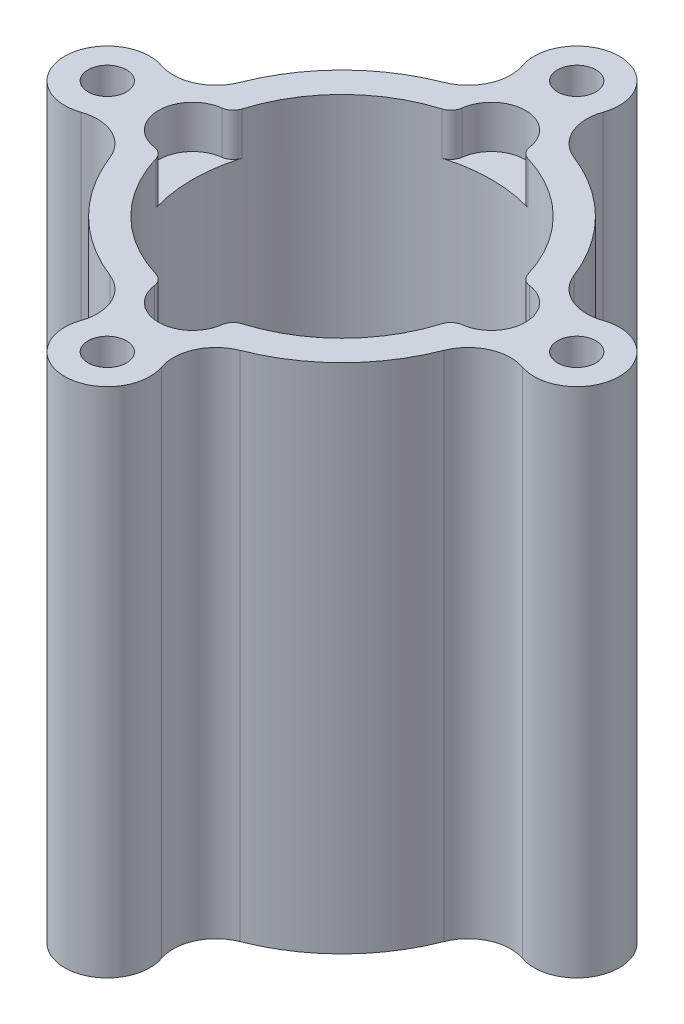
from build123d import *

# Parameters (mm, degrees)
SKETCH_1_R          = 2.25
SKETCH_1_R_2        = 17.5
EXTRUDE_1_DEPTH     = 60
CUT_EXTRUDE_START   = -5
CUT_EXTRUDE_1_DEPTH = 5


with BuildPart() as part:
    # ｽｹｯﾁ1 → ﾎﾞｽ - 押し出し1 (new body)
    with BuildSketch(Plane(origin=(0, 0, 0), x_dir=(1, 0, 0), z_dir=(0, 1, 0))):
        with BuildLine():
            ThreePointArc((7.630853773, 19.56451049), (4.908133096, 22.126989461), (4.72386186, 25.861363636))
            ThreePointArc((4.72386186, 25.861363636), (4.887569521, 26.445645137), (4.979295977, 27.045454545))
            ThreePointArc((4.979295977, 27.045454545), (0, 32.5), (-4.979295977, 27.045454545))
            ThreePointArc((-4.979295977, 27.045454545), (-4.887569521, 26.445645137), (-4.72386186, 25.861363636))
            ThreePointArc((-4.72386186, 25.861363636), (-4.908133096, 22.126989461), (-7.630853773, 19.56451049))
            ThreePointArc((-7.630853773, 19.56451049), (-14.849242405, 14.849242405), (-19.56451049, 7.630853773))
            ThreePointArc((-19.56451049, 7.630853773), (-22.126989461, 4.908133096), (-25.861363636, 4.72386186))
            ThreePointArc((-25.861363636, 4.72386186), (-26.445645137, 4.887569521), (-27.045454545, 4.979295977))
            ThreePointArc((-27.045454545, 4.979295977), (-32.5, 0), (-27.045454545, -4.979295977))
            ThreePointArc((-27.045454545, -4.979295977), (-26.445645137, -4.887569521), (-25.861363636, -4.72386186))
            ThreePointArc((-25.861363636, -4.72386186), (-22.126989461, -4.908133096), (-19.56451049, -7.630853773))
            ThreePointArc((-19.56451049, -7.630853773), (-14.849242405, -14.849242405), (-7.630853773, -19.56451049))
            ThreePointArc((-7.630853773, -19.56451049), (-4.908133096, -22.126989461), (-4.72386186, -25.861363636))
            ThreePointArc((-4.72386186, -25.861363636), (-4.887569521, -26.445645137), (-4.979295977, -27.045454545))
            ThreePointArc((-4.979295977, -27.045454545), (0, -32.5), (4.979295977, -27.045454545))
            ThreePointArc((4.979295977, -27.045454545), (4.887569521, -26.445645137), (4.72386186, -25.861363636))
            ThreePointArc((4.72386186, -25.861363636), (4.908133096, -22.126989461), (7.630853773, -19.56451049))
            ThreePointArc((7.630853773, -19.56451049), (14.849242405, -14.849242405), (19.56451049, -7.630853773))
            ThreePointArc((19.56451049, -7.630853773), (22.126989461, -4.908133096), (25.861363636, -4.72386186))
            ThreePointArc((25.861363636, -4.72386186), (26.445645137, -4.887569521), (27.045454545, -4.979295977))
            ThreePointArc((27.045454545, -4.979295977), (32.5, 0), (27.045454545, 4.979295977))
            ThreePointArc((27.045454545, 4.979295977), (26.445645137, 4.887569521), (25.861363636, 4.72386186))
            ThreePointArc((25.861363636, 4.72386186), (22.126989461, 4.908133096), (19.56451049, 7.630853773))
            ThreePointArc((19.56451049, 7.630853773), (14.849242405, 14.849242405), (7.630853773, 19.56451049))
        make_face()
        with Locations((-27.5, 0)):
            Circle(SKETCH_1_R, mode=Mode.SUBTRACT)
        with Locations((0, -27.5)):
            Circle(SKETCH_1_R, mode=Mode.SUBTRACT)
        Circle(SKETCH_1_R_2, mode=Mode.SUBTRACT)
        with Locations((27.5, 0)):
            Circle(SKETCH_1_R, mode=Mode.SUBTRACT)
        with Locations((0, 27.5)):
            Circle(SKETCH_1_R, mode=Mode.SUBTRACT)
    extrude(amount=EXTRUDE_1_DEPTH)

    # ｽｹｯﾁ2 → ｶｯﾄ - 押し出し1 (cut)
    with BuildSketch(Plane(origin=(0, 60, 0), x_dir=(1, 0, 0), z_dir=(0, 1, 0)).offset(CUT_EXTRUDE_START)):
        with BuildLine():
            ThreePointArc((3.967471039, 18.009090909), (0, 21.5), (-3.967471039, 18.009090909))
            ThreePointArc((-3.967471039, 18.009090909), (-4.311494, 17.229551477), (-5.024593257, 16.763157895))
            ThreePointArc((-5.024593257, 16.763157895), (0, 17.5), (5.024593257, 16.763157895))
            ThreePointArc((5.024593257, 16.763157895), (4.311494, 17.229551477), (3.967471039, 18.009090909))
        make_face()
        with BuildLine():
            ThreePointArc((18.009090909, -3.967471039), (17.229551477, -4.311494), (16.763157895, -5.024593257))
            ThreePointArc((16.763157895, -5.024593257), (17.5, 0), (16.763157895, 5.024593257))
            ThreePointArc((16.763157895, 5.024593257), (17.229551477, 4.311494), (18.009090909, 3.967471039))
            ThreePointArc((18.009090909, 3.967471039), (21.5, 0), (18.009090909, -3.967471039))
        make_face()
        with BuildLine():
            ThreePointArc((-3.967471039, -18.009090909), (-4.311494, -17.229551477), (-5.024593257, -16.763157895))
            ThreePointArc((-5.024593257, -16.763157895), (0, -17.5), (5.024593257, -16.763157895))
            ThreePointArc((5.024593257, -16.763157895), (4.311494, -17.229551477), (3.967471039, -18.009090909))
            ThreePointArc((3.967471039, -18.009090909), (0, -21.5), (-3.967471039, -18.009090909))
        make_face()
        with BuildLine():
            ThreePointArc((-18.009090909, 3.967471039), (-17.229551477, 4.311494), (-16.763157895, 5.024593257))
            ThreePointArc((-16.763157895, 5.024593257), (-17.5, 0), (-16.763157895, -5.024593257))
            ThreePointArc((-16.763157895, -5.024593257), (-17.229551477, -4.311494), (-18.009090909, -3.967471039))
            ThreePointArc((-18.009090909, -3.967471039), (-21.5, 0), (-18.009090909, 3.967471039))
        make_face()
    extrude(amount=CUT_EXTRUDE_1_DEPTH, mode=Mode.SUBTRACT)


solid = part.part
